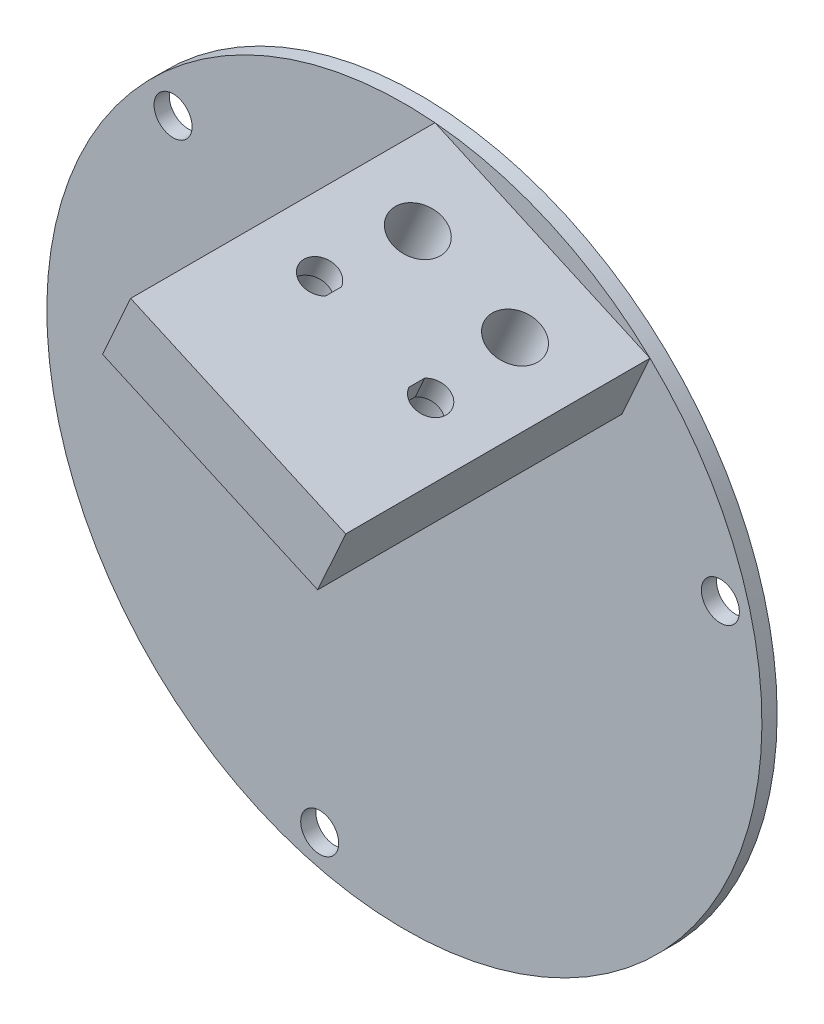
from build123d import *

# Parameters (mm, degrees)
SKETCH1_R           = 47
BOSS_EXTRUDE1_DEPTH = 2
SKETCH3_R           = 2.5
CUT_EXTRUDE1_DEPTH  = 67.498120274
BOSS_EXTRUDE2_DEPTH = 40
CUT_EXTRUDE3_REACH  = 118.892
SKETCH8_R           = 3.25
SKETCH9_W           = 11
SKETCH9_H           = 13
CUT_EXTRUDE4_DEPTH  = 1
SKETCH10_R          = 3.125
CUT_EXTRUDE5_DEPTH  = 6


with BuildPart() as part:
    # Sketch1 → Boss-Extrude1 (new body)
    with BuildSketch(Plane.XY):
        Circle(SKETCH1_R)
    extrude(amount=BOSS_EXTRUDE1_DEPTH)

    # Sketch3 → Cut-Extrude1 (cut, through all)
    with BuildSketch(Plane(origin=(0, 0, 0), x_dir=(-1, 0, 0), z_dir=(0, 0, -1))):
        with Locations((30.405591591, 30.405591591)):
            Circle(SKETCH3_R)
        with Locations((11.129218939, -41.53481053)):
            Circle(SKETCH3_R)
        with Locations((-41.53481053, 11.129218939)):
            Circle(SKETCH3_R)
    extrude(amount=-CUT_EXTRUDE1_DEPTH, mode=Mode.SUBTRACT)

    # Sketch4 → Boss-Extrude2 (add)
    with BuildSketch(Plane.XY.offset(2)):
        Polygon((4.020989493, 46.827680313), (32.287890293, 34.153947655), (28.605815439, 25.941620045), (0.338914639, 38.615352703), align=None)
    extrude(amount=BOSS_EXTRUDE2_DEPTH)

    # Sketch8 → Cut-Extrude3 (cut, up to next)
    with BuildSketch(Plane(origin=(18.154439893, 40.490813984, 0), x_dir=(0.9124808455439009, -0.4091194281814147, 0), z_dir=(0.4091194281814148, 0.912480845543901, 0)), mode=Mode.PRIVATE) as cut_extrude3_sk1:
        with Locations((7, -12)):
            Circle(SKETCH8_R)
    cut_extrude3_tool1 = extrude(cut_extrude3_sk1.sketch, amount=-CUT_EXTRUDE3_REACH, mode=Mode.PRIVATE) & part.part
    # Sketch8 → Cut-Extrude3 (cut, up to next)
    with BuildSketch(Plane(origin=(18.154439893, 40.490813984, 0), x_dir=(0.9124808455439009, -0.4091194281814147, 0), z_dir=(0.4091194281814148, 0.912480845543901, 0)), mode=Mode.PRIVATE) as cut_extrude3_sk2:
        with Locations((-7, -12)):
            Circle(SKETCH8_R)
    cut_extrude3_tool2 = extrude(cut_extrude3_sk2.sketch, amount=-CUT_EXTRUDE3_REACH, mode=Mode.PRIVATE) & part.part
    # Sketch8 → Cut-Extrude3 (cut, up to next)
    with BuildSketch(Plane(origin=(18.154439893, 40.490813984, 0), x_dir=(0.9124808455439009, -0.4091194281814147, 0), z_dir=(0.4091194281814148, 0.912480845543901, 0)), mode=Mode.PRIVATE) as cut_extrude3_sk3:
        with BuildLine():
            Line((6, -22.969223594), (6, -25.030776406))
            ThreePointArc((6, -25.030776406), (10.25, -24), (6, -22.969223594))
        make_face()
    cut_extrude3_tool3 = extrude(cut_extrude3_sk3.sketch, amount=-CUT_EXTRUDE3_REACH, mode=Mode.PRIVATE) & part.part
    # Sketch8 → Cut-Extrude3 (cut, up to next)
    with BuildSketch(Plane(origin=(18.154439893, 40.490813984, 0), x_dir=(0.9124808455439009, -0.4091194281814147, 0), z_dir=(0.4091194281814148, 0.912480845543901, 0)), mode=Mode.PRIVATE) as cut_extrude3_sk4:
        with BuildLine():
            Line((-6, -22.969223594), (-6, -25.030776406))
            ThreePointArc((-6, -25.030776406), (-10.25, -24), (-6, -22.969223594))
        make_face()
    cut_extrude3_tool4 = extrude(cut_extrude3_sk4.sketch, amount=-CUT_EXTRUDE3_REACH, mode=Mode.PRIVATE) & part.part
    add(cut_extrude3_tool1.solids().sort_by_distance((24.541806, 37.626978, 12))[0], mode=Mode.SUBTRACT)
    add(cut_extrude3_tool2.solids().sort_by_distance((11.767074, 43.35465, 12))[0], mode=Mode.SUBTRACT)
    add(cut_extrude3_tool3.solids().sort_by_distance((25.497113, 37.198657, 24))[0], mode=Mode.SUBTRACT)
    add(cut_extrude3_tool4.solids().sort_by_distance((10.811767, 43.782971, 24))[0], mode=Mode.SUBTRACT)

    # Sketch9 → Cut-Extrude4 (cut)
    with BuildSketch(Plane(origin=(14.472365039, 32.278486374, 0), x_dir=(0.9124808455439007, -0.40911942818141506, 0), z_dir=(-0.40911942818141506, -0.9124808455439007, 0))):
        with Locations((-7, 12)):
            Rectangle(SKETCH9_W, SKETCH9_H)
        with Locations((7, 12)):
            Rectangle(SKETCH9_W, SKETCH9_H)
    extrude(amount=-CUT_EXTRUDE4_DEPTH, mode=Mode.SUBTRACT)

    # Sketch10 → Cut-Extrude5 (cut)
    with BuildSketch(Plane(origin=(14.472365039, 32.278486374, 0), x_dir=(0.9124808455439007, -0.40911942818141506, 0), z_dir=(-0.40911942818141506, -0.9124808455439007, 0))):
        with Locations((8, 24)):
            Circle(SKETCH10_R)
        with Locations((-8, 24)):
            Circle(SKETCH10_R)
    extrude(amount=-CUT_EXTRUDE5_DEPTH, mode=Mode.SUBTRACT)


solid = part.part
